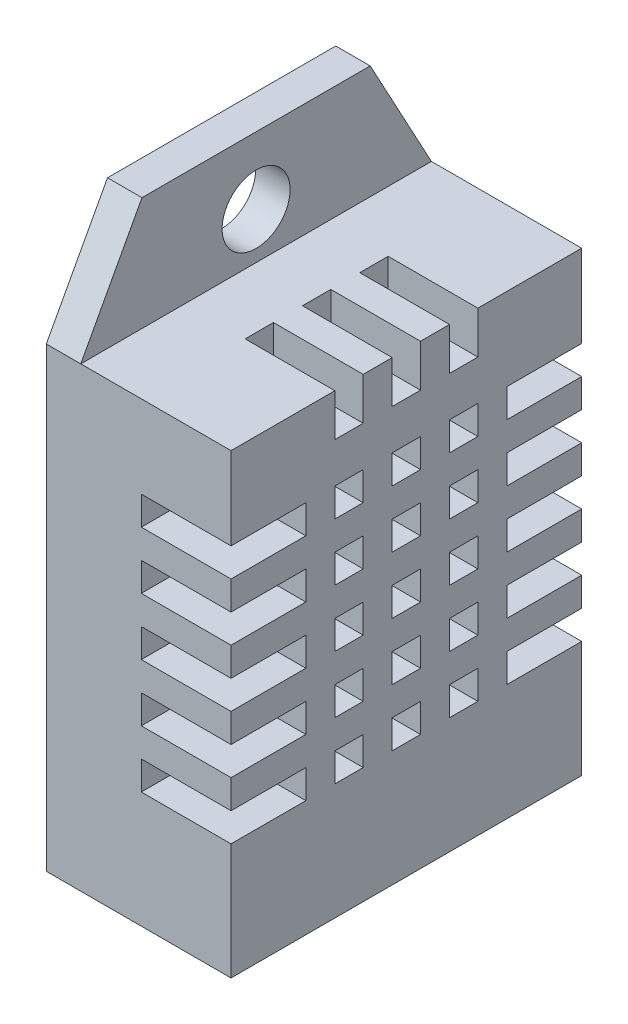
from build123d import *

# Parameters (mm, degrees)
SKETCH1_W           = 15.47
SKETCH1_H           = 20.15
BOSS_EXTRUDE1_DEPTH = 8.15
SKETCH1_4_R         = 1.5
SKETCH1_4_W         = 15.47
SKETCH1_4_H         = 20.15
BOSS_EXTRUDE2_DEPTH = 1.52
SHELL1_START        = -6.455
SHELL1_OUTLINE_W    = 5.59
SHELL1_OUTLINE_H    = 17.59
SHELL1_DEPTH        = 12.91
SKETCH2_W           = 1.25
SKETCH2_H           = 1.87
SKETCH2_H_2         = 1.264229858
SKETCH2_W_2         = 3.3
CUT_EXTRUDE1_DEPTH  = 3.96
SKETCH3_R           = 0.15
BOSS_EXTRUDE3_DEPTH = 2.8
SKETCH5_R           = 0.15
BOSS_EXTRUDE4_DEPTH = 10
SKETCH6_W           = 12.820834602
SKETCH6_H           = 2.081733453
CUT_EXTRUDE2_DEPTH  = 6.8


# Read off the part's stored shape, not the designer's step: Shell1
with BuildPart() as part:
    # Sketch1 → Boss-Extrude1 (new body)
    with BuildSketch(Plane(origin=(0, 0, 0), x_dir=(0, 0, -1), z_dir=(1, 0, 0))):
        with Locations((0, -2.5)):
            Rectangle(SKETCH1_W, SKETCH1_H)
    extrude(amount=BOSS_EXTRUDE1_DEPTH)

    # Sketch1<4> → Boss-Extrude2 (add)
    # profile 1 of 2: a face of its own
    with BuildSketch(Plane(origin=(0, 0, 0), x_dir=(0, 0, -1), z_dir=(1, 0, 0))):
        Polygon((-5.035, 12.575), (-7.735, 7.575), (7.735, 7.575), (5.035, 12.575), align=None)
        with Locations((0, 9.615)):
            Circle(SKETCH1_4_R, mode=Mode.SUBTRACT)
    # profile 2 of 2: a face of its own
    with BuildSketch(Plane(origin=(0, 0, 0), x_dir=(0, 0, -1), z_dir=(1, 0, 0))):
        with Locations((0, -2.5)):
            Rectangle(SKETCH1_4_W, SKETCH1_4_H)
    extrude(amount=BOSS_EXTRUDE2_DEPTH)

    # Shell1 outline → Shell1 (cut)
    with BuildSketch(Plane.XY.offset(SHELL1_START)):
        with Locations((4.075, -2.5)):
            Rectangle(SHELL1_OUTLINE_W, SHELL1_OUTLINE_H)
    extrude(amount=SHELL1_DEPTH, mode=Mode.SUBTRACT)

    # Sketch2 → Cut-Extrude1 (cut)
    with BuildSketch(Plane(origin=(8.15, 0, 0), x_dir=(0, 0, -1), z_dir=(1, 0, 0))):
        with Locations((0, 6.64)):
            Rectangle(SKETCH2_W, SKETCH2_H)
        with Locations((2.53, 6.64)):
            Rectangle(SKETCH2_W, SKETCH2_H)
        with Locations((2.53, 0.772885071)):
            Rectangle(SKETCH2_W, SKETCH2_H_2)
        with Locations((6.085, 0.772885071)):
            Rectangle(SKETCH2_W_2, SKETCH2_H_2)
        with Locations((6.085, 3.302885071)):
            Rectangle(SKETCH2_W_2, SKETCH2_H_2)
        with Locations((0, 3.302885071)):
            Rectangle(SKETCH2_W, SKETCH2_H_2)
        with Locations((-2.53, 0.772885071)):
            Rectangle(SKETCH2_W, SKETCH2_H_2)
        with Locations((-2.53, 3.302885071)):
            Rectangle(SKETCH2_W, SKETCH2_H_2)
        with Locations((-6.085, 3.302885071)):
            Rectangle(SKETCH2_W_2, SKETCH2_H_2)
        with Locations((-6.085, 0.772885071)):
            Rectangle(SKETCH2_W_2, SKETCH2_H_2)
        with Locations((-6.085, -1.757114929)):
            Rectangle(SKETCH2_W_2, SKETCH2_H_2)
        with Locations((-6.085, -4.287114929)):
            Rectangle(SKETCH2_W_2, SKETCH2_H_2)
        with Locations((-2.53, -1.757114929)):
            Rectangle(SKETCH2_W, SKETCH2_H_2)
        with Locations((0, -1.757114929)):
            Rectangle(SKETCH2_W, SKETCH2_H_2)
        with Locations((2.53, -1.757114929)):
            Rectangle(SKETCH2_W, SKETCH2_H_2)
        with Locations((6.085, -1.757114929)):
            Rectangle(SKETCH2_W_2, SKETCH2_H_2)
        with Locations((6.085, -4.287114929)):
            Rectangle(SKETCH2_W_2, SKETCH2_H_2)
        with Locations((2.53, -4.287114929)):
            Rectangle(SKETCH2_W, SKETCH2_H_2)
        with Locations((0, -4.287114929)):
            Rectangle(SKETCH2_W, SKETCH2_H_2)
        with Locations((-2.53, -4.287114929)):
            Rectangle(SKETCH2_W, SKETCH2_H_2)
        with Locations((6.085, -6.817114929)):
            Rectangle(SKETCH2_W_2, SKETCH2_H_2)
        with Locations((2.53, -6.817114929)):
            Rectangle(SKETCH2_W, SKETCH2_H_2)
        with Locations((-2.53, -6.817114929)):
            Rectangle(SKETCH2_W, SKETCH2_H_2)
        with Locations((-6.085, -6.817114929)):
            Rectangle(SKETCH2_W_2, SKETCH2_H_2)
        with Locations((-2.53, 6.64)):
            Rectangle(SKETCH2_W, SKETCH2_H)
        with Locations((2.53, 3.302885071)):
            Rectangle(SKETCH2_W, SKETCH2_H_2)
        with Locations((0, 0.772885071)):
            Rectangle(SKETCH2_W, SKETCH2_H_2)
        with Locations((0, -6.817114929)):
            Rectangle(SKETCH2_W, SKETCH2_H_2)
    extrude(amount=-CUT_EXTRUDE1_DEPTH, mode=Mode.SUBTRACT)

    # Sketch3 → Boss-Extrude3 (add)
    with BuildSketch(Plane.XZ.offset(12.575)):
        with Locations(Location((2.31, 3.704312159, 0), (0, 0, 90))):
            Circle(SKETCH3_R)
        with Locations(Location((2.31, 1.164312159, 0), (0, 0, 90))):
            Circle(SKETCH3_R)
        with Locations(Location((2.31, -1.375687841, 0), (0, 0, 90))):
            Circle(SKETCH3_R)
        with Locations(Location((2.31, -3.915687841, 0), (0, 0, 90))):
            Circle(SKETCH3_R)
    extrude(amount=BOSS_EXTRUDE3_DEPTH)

    # Sketch5 → Boss-Extrude4 (add)
    with BuildSketch(Plane.ZY):
        with Locations((-3.915687841, -15.375)):
            Circle(SKETCH5_R)
        with Locations((-1.375687841, -15.375)):
            Circle(SKETCH5_R)
        with Locations((1.164312159, -15.375)):
            Circle(SKETCH5_R)
        with Locations((3.704312159, -15.375)):
            Circle(SKETCH5_R)
    extrude(amount=-BOSS_EXTRUDE4_DEPTH)

    # Sketch6 → Cut-Extrude2 (cut)
    with BuildSketch(Plane(origin=(10, 0, 0), x_dir=(0, 0, -1), z_dir=(1, 0, 0))):
        with Locations((0.462607434, -15.485384076)):
            Rectangle(SKETCH6_W, SKETCH6_H)
    extrude(amount=-CUT_EXTRUDE2_DEPTH, mode=Mode.SUBTRACT)


solid = part.part
